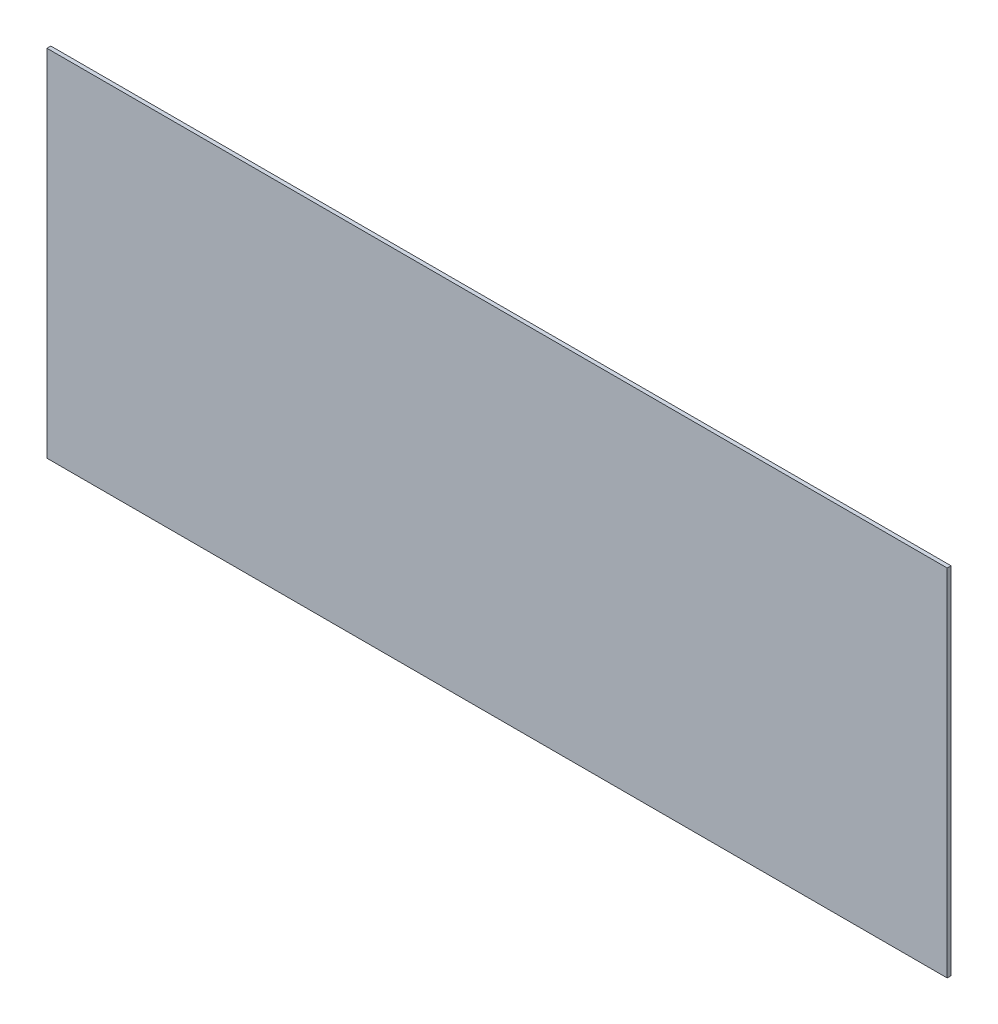
from build123d import *

# Parameters (mm, degrees)
SKETCH1_W           = 736.6
SKETCH1_H           = 290.5125
BOSS_EXTRUDE1_DEPTH = 3.175


with BuildPart() as part:
    # Sketch1 → Boss-Extrude1 (new body)
    with BuildSketch(Plane.XY):
        with Locations((368.3, -145.25625)):
            Rectangle(SKETCH1_W, SKETCH1_H)
    extrude(amount=BOSS_EXTRUDE1_DEPTH)


solid = part.part
